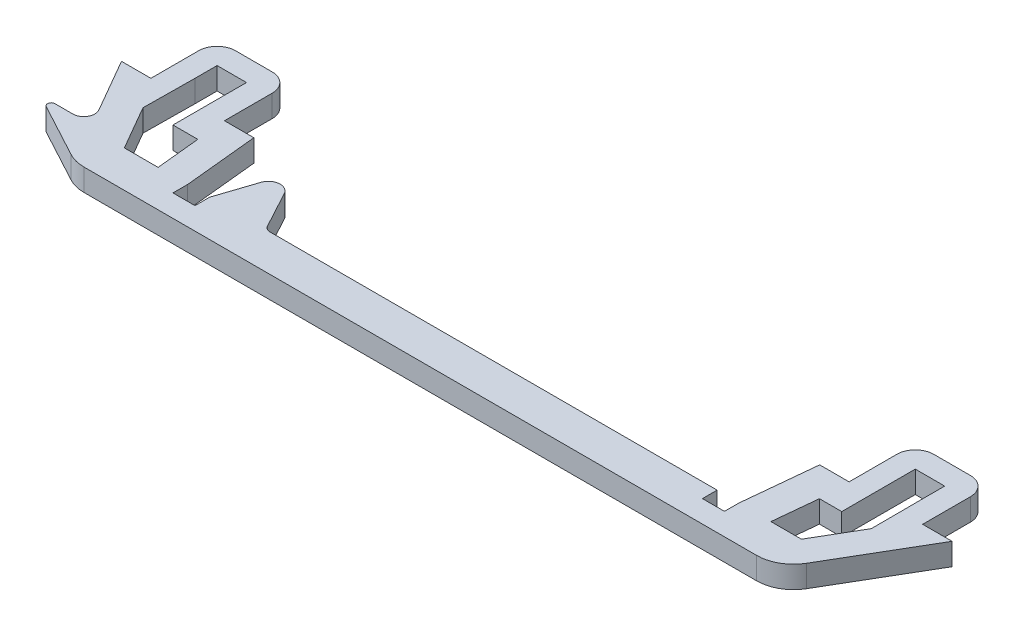
from build123d import *

# Parameters (mm, degrees)
BOSS_EXTRUDE1_DEPTH = 3
FILLET1_R           = 5
FILLET2_R           = 2.5
FILLET3_R           = 1


with BuildPart() as part:
    # Sketch1 → Boss-Extrude1 (new body)
    with BuildSketch(Plane(origin=(0, 0, 0), x_dir=(1, 0, 0), z_dir=(0, 1, 0))):
        with BuildLine():
            Line((-62.418566214, -47.1586621), (-58.418566214, -47.1586621))
            Line((-58.418566214, -47.1586621), (-58.418566214, -38.1586621))
            Line((-58.418566214, -38.1586621), (-48.418566214, -38.1586621))
            Line((-48.418566214, -38.1586621), (-48.418566214, -47.1586621))
            Line((-48.418566214, -47.1586621), (-44.418566214, -47.1586621))
            Line((-44.418566214, -47.1586621), (-43.418817081, -57.156153425))
            Line((-43.418817081, -57.156153425), (-43.418817081, -59.1586621))
            Line((-43.418817081, -59.1586621), (-40.418817081, -59.1586621))
            Line((-40.418817081, -59.1586621), (-40.418817081, -57.1586621))
            Line((-40.418817081, -57.1586621), (-38.682853905, -51.924562388))
            ThreePointArc((-38.682853905, -51.924562388), (-37.311808452, -50.840242209), (-35.772499384, -51.668519625))
            Line((-35.772499384, -51.668519625), (-32.803457275, -57.1586621))
            Line((-32.803457275, -57.1586621), (28.581433786, -57.1586621))
            Line((28.581433786, -57.1586621), (28.581433786, -59.1586621))
            Line((28.581433786, -59.1586621), (31.581433786, -59.1586621))
            Line((31.581433786, -59.1586621), (31.581433786, -57.208800497))
            Line((31.581433786, -57.208800497), (32.581433786, -47.211334262))
            Line((32.581433786, -47.211334262), (36.581433786, -47.211334262))
            Line((36.581433786, -47.211334262), (36.581433786, -38.211334262))
            Line((36.581433786, -38.211334262), (46.581433786, -38.211334262))
            Line((46.581433786, -38.211334262), (46.581433786, -47.211334262))
            Line((46.581433786, -47.211334262), (50.581433786, -47.211334262))
            Line((50.581433786, -47.211334262), (41.830582941, -62.1586621))
            Line((41.830582941, -62.1586621), (-53.758312176, -62.1586621))
            Line((-53.758312176, -62.1586621), (-62.202371167, -57.610709304))
            ThreePointArc((-62.202371167, -57.610709304), (-62.450096964, -57.048239346), (-61.965274707, -56.670498822))
            Line((-61.965274707, -56.670498822), (-59.524980934, -56.670498822))
            ThreePointArc((-59.524980934, -56.670498822), (-58.225942828, -55.920498822), (-58.225942828, -54.420498822))
            Line((-58.225942828, -54.420498822), (-62.418566214, -47.1586621))
        make_face()
        Polygon((36.547763078, -51.211334262), (39.581433786, -51.211334262), (39.581433786, -44.211334262), (39.581433786, -41.211334262), (43.581433786, -41.211334262), (43.581433786, -44.211334262), (43.604572315, -51.211334262), (40.093380681, -57.208800497), (35.947864455, -57.208800497), align=None, mode=Mode.SUBTRACT)
        Polygon((-55.418566214, -41.1586621), (-51.418566214, -41.1586621), (-51.418566214, -44.1586621), (-51.418566214, -51.1586621), (-48.038516462, -51.1586621), (-47.438516462, -57.1586621), (-52.026261368, -57.1586621), (-55.490362984, -51.1586621), (-55.418566214, -44.1586621), align=None, mode=Mode.SUBTRACT)
    extrude(amount=BOSS_EXTRUDE1_DEPTH)

    # Fillet1
    fillet1_edges = [part.edges().sort_by_distance(p)[0] for p in [
        (41.830582941, 1.5, 62.1586621),
        (-53.758312176, 1.5, 62.1586621),
    ]]
    fillet(fillet1_edges, radius=FILLET1_R)

    # Fillet2
    fillet2_edges = [part.edges().sort_by_distance(p)[0] for p in [
        (46.581433786, 1.5, 38.211334262),
        (36.581433786, 1.5, 38.211334262),
        (-58.418566214, 1.5, 38.1586621),
        (-48.418566214, 1.5, 38.1586621),
    ]]
    fillet(fillet2_edges, radius=FILLET2_R)

    # Fillet3
    fillet3_edges = [part.edges().sort_by_distance(p)[0] for p in [
        (-32.803457275, 1.5, 57.1586621),
    ]]
    fillet(fillet3_edges, radius=FILLET3_R)


solid = part.part
